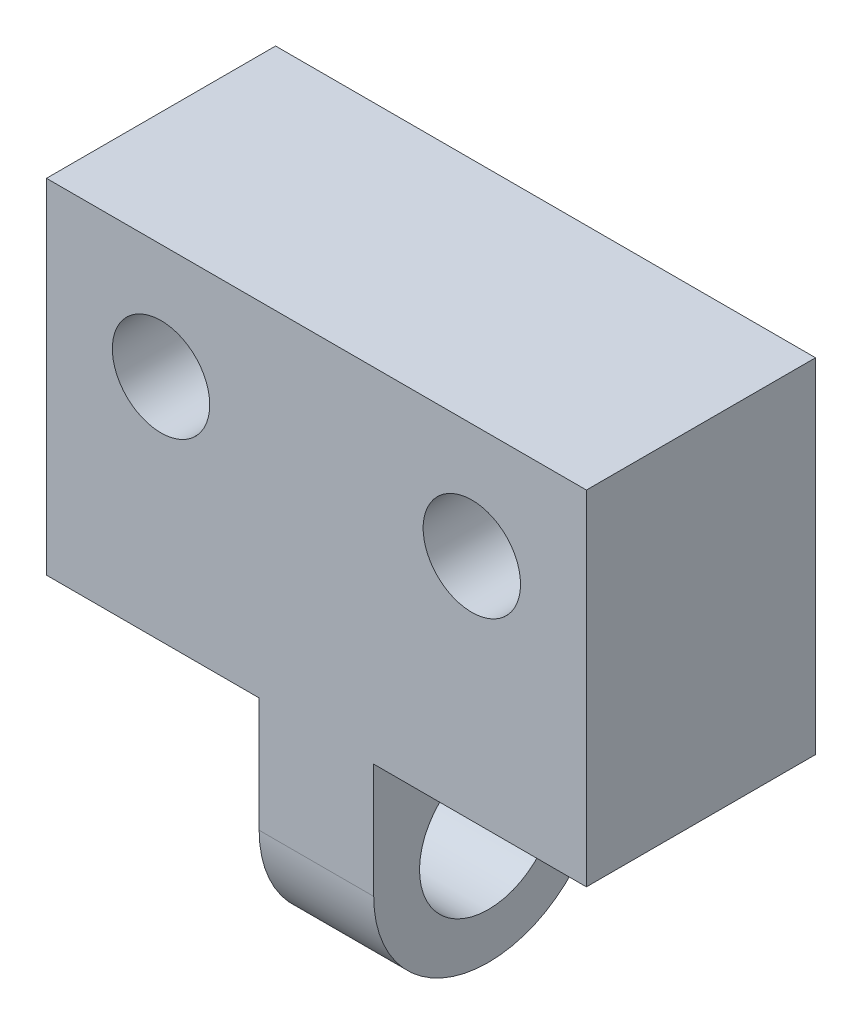
from build123d import *

# Parameters (mm, degrees)
EXTRUDE1_DEPTH                 = 20
F_12_0_12_DIAMETER_HOLE1_D     = 12
F_12_0_12_DIAMETER_HOLE1_DEPTH = 47.13
F_12_0_12_DIAMETER_HOLE1_TIP   = 3.605163714
F_8_5_8_5_DIAMETER_HOLE2_D     = 8.5
FILLET1_R                      = 10


with BuildPart() as part:
    # Sketch1 → Extrude1 (new body)
    with BuildSketch(Plane.XY):
        Polygon((0, 12.157460585), (18.564852768, 12.157460585), (18.564852768, -7.842539415), (28.564852768, -7.842539415), (28.564852768, 12.157460585), (47.129705535, 12.157460585), (47.129705535, 42.157460585), (0, 42.157460585), align=None)
    extrude(amount=EXTRUDE1_DEPTH)

    # Ø12.0 (12) Diameter Hole1
    with Locations(Plane(origin=(47.129705535, 2.157460585, 10), x_dir=(0, 0, 1), z_dir=(1, 0, 0))):
        with Locations((0, 0)):
            Hole(F_12_0_12_DIAMETER_HOLE1_D / 2, depth=F_12_0_12_DIAMETER_HOLE1_DEPTH)
            with Locations((0, 0, -(F_12_0_12_DIAMETER_HOLE1_DEPTH + F_12_0_12_DIAMETER_HOLE1_TIP / 2))):  # 118° drill point
                Cone(0, F_12_0_12_DIAMETER_HOLE1_D / 2, F_12_0_12_DIAMETER_HOLE1_TIP, mode=Mode.SUBTRACT)

    # Ø8.5 (8.5) Diameter Hole2 (through all)
    with Locations(Plane(origin=(37.129705535, 32.157460585, 20), x_dir=(1, 0, 0), z_dir=(0, 0, 1))):
        with Locations((0, 0), (-27.129705535, 0)):
            Hole(F_8_5_8_5_DIAMETER_HOLE2_D / 2)

    # Fillet1
    fillet1_edges = [part.edges().sort_by_distance(p)[0] for p in [
        (23.564852768, -7.842539415, 20),
        (23.564852768, -7.842539415, 0),
    ]]
    fillet(fillet1_edges, radius=FILLET1_R - 0.0001)  # a hair under: the kernel refuses the full size


solid = part.part
